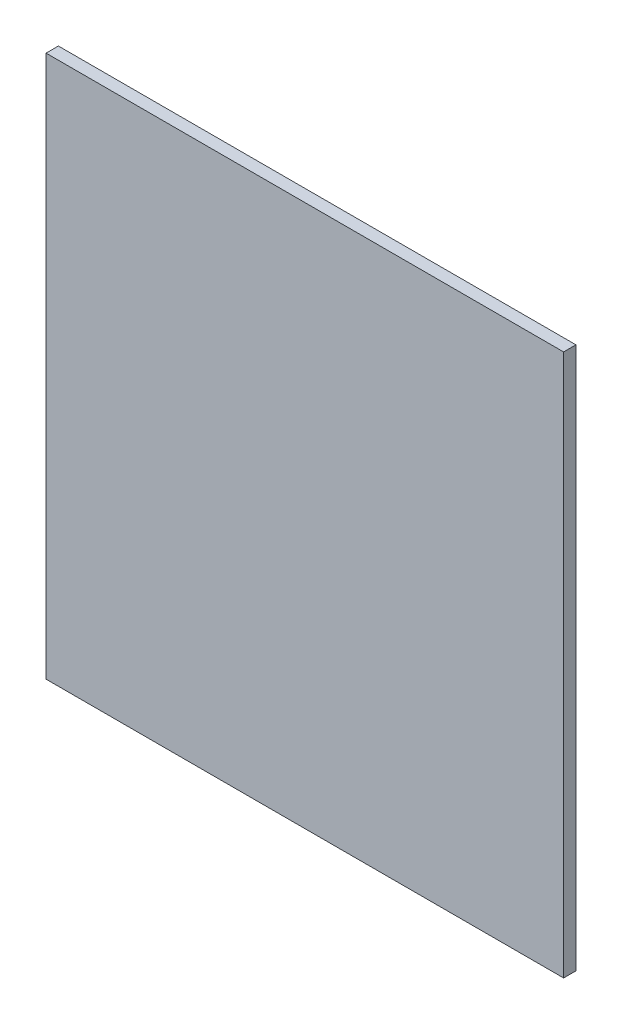
from build123d import *

# Parameters (mm, degrees)
SKETCH1_W           = 84
SKETCH1_H           = 88
BOSS_EXTRUDE1_DEPTH = 2


with BuildPart() as part:
    # Sketch1 → Boss-Extrude1 (new body)
    with BuildSketch(Plane.XY):
        with Locations((-27.854657196, 19.8829867)):
            Rectangle(SKETCH1_W, SKETCH1_H)
    extrude(amount=BOSS_EXTRUDE1_DEPTH)


solid = part.part
